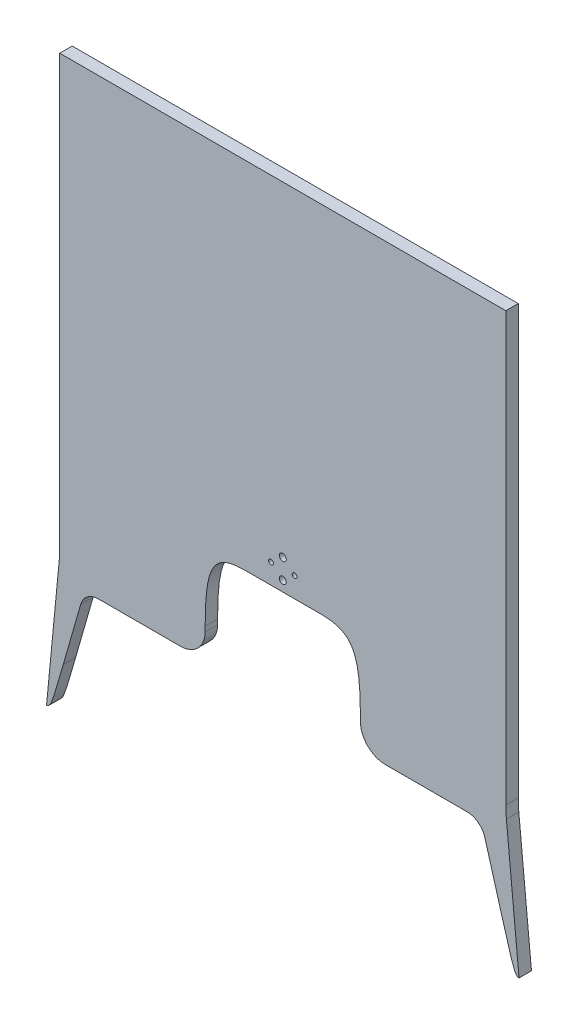
from build123d import *

# Parameters (mm, degrees)
BOSS_EXTRUDE1_DEPTH     = 12.7
FILLET2_SIZE            = 41.275
FILLET2_SIZE_2          = 69.85
FILLET3_R               = 25.4
FILLET4_R               = 19.05
FILLET5_START           = -1
FILLET5_DEPTH           = 15
FILLET6_R               = 127
CUT_EXTRUDE1_REACH      = 634.314
SKETCH3_W               = 241.600142069
SKETCH3_H               = 584.2
F_8_CLEARANCE_HOLE1_D   = 4.9149
F_1_4_CLEARANCE_HOLE1_D = 7.14248


with BuildPart() as part:
    # Sketch1 → Boss-Extrude1 (new body)
    with BuildSketch(Plane.XY):
        Polygon((-228.088766336, 0), (228.088766336, 0), (228.088766336, -443.878997916), (241.600142069, -584.2), (237.284597128, -584.2), (202.688766336, -463.55), (79.375, -463.55), (79.375, -363.22), (-79.375, -363.22), (-79.375, -463.55), (-202.688766336, -463.55), (-237.284597128, -584.2), (-241.600142069, -584.2), (-228.088766336, -443.878997916), align=None)
    extrude(amount=BOSS_EXTRUDE1_DEPTH)

    # Fillet2
    # a fillet whose section is not a circle: 69.85, 41.275 mm, written as the material it adds along each edge
    with BuildSketch(Plane(origin=(-79.375, -363.22, 0), x_dir=(1, 0, 0), z_dir=(0, 0, 1))) as fillet2_piece_1:
        with BuildLine():
            Bezier((FILLET2_SIZE, 0), (0, 0), (0, -FILLET2_SIZE_2), weights=[1, 1.5, 1])
            Line((0, -FILLET2_SIZE_2), (0, 0))
            Line((0, 0), (FILLET2_SIZE, 0))
        make_face()
    extrude(amount=12.7)

    # Fillet3
    fillet3_edges = [part.edges().sort_by_distance(p)[0] for p in [
        (-79.375, -463.55, 6.35),
    ]]
    fillet(fillet3_edges, radius=FILLET3_R)

    # Fillet4
    fillet4_edges = [part.edges().sort_by_distance(p)[0] for p in [
        (-202.688766336, -463.55, 6.35),
    ]]
    fillet(fillet4_edges, radius=FILLET4_R)

    # Fillet5: read off the stored shape, not the designer's step
    # Fillet5 outline → Fillet5 (cut)
    with BuildSketch(Plane.XY.offset(FILLET5_START)):
        with BuildLine():
            Line((-237.284597128, -584.2), (-224.526592015, -539.707548693))
            add(Edge.make_bspline(
                [(-224.526592015, -539.707548693), (-237.177095318, -583.825096633), (-241.600142069, -584.2)],
                knots=[0, 0, 0, 1, 1, 1], degree=2, weights=[1, 2.333333333, 1]))
            Line((-241.600142069, -584.2), (-237.284597128, -584.2))
        make_face()
    extrude(amount=FILLET5_DEPTH, mode=Mode.SUBTRACT)

    # Fillet6
    # the kernel refuses this fillet: 127 mm, written as the material it adds along each edge
    with BuildSketch(Plane(origin=(-228.088766336, -443.878997916, 0), x_dir=(0, 1, 0), z_dir=(0, 0, 1))) as fillet6_piece_1:
        with BuildLine():
            CenterArc((FILLET6_R * 0.0480334444852, FILLET6_R), FILLET6_R, 264.5, 5.5)
            Line((-FILLET6_R * 0.047812308035, FILLET6_R * 0.00460380163282), (0, 0))
            Line((0, 0), (FILLET6_R * 0.0480334444852, 0))
        make_face()
    extrude(amount=12.7)

    # Sketch3 → Cut-Extrude1 (cut, up to next)
    with BuildSketch(Plane.XY.offset(12.7), mode=Mode.PRIVATE) as cut_extrude1_sk1:
        with Locations((120.800071035, -292.1)):
            Rectangle(SKETCH3_W, SKETCH3_H)
    cut_extrude1_tool1 = extrude(cut_extrude1_sk1.sketch, amount=-CUT_EXTRUDE1_REACH, mode=Mode.PRIVATE) & part.part
    add(cut_extrude1_tool1.solids().sort_by_distance((120.800071, -292.1, 12.7))[0], mode=Mode.SUBTRACT)

    # Mirror5: part across plane


with BuildPart() as part_1:
    add(part.part)
    add(part.part.mirror(Plane(origin=(0, 0, -0.35025), x_dir=(0, 0, 1), z_dir=(-1, 0, 0))))

    # #8 Clearance Hole1 (through all)
    with Locations(Plane(origin=(0, 0, 0), x_dir=(-1, 0, 0), z_dir=(0, 0, -1))):
        with Locations((12.077216058, -342.5825), (-12.077216058, -342.5825)):
            Hole(F_8_CLEARANCE_HOLE1_D / 2)

    # 1/4 Clearance Hole1 (through all)
    with Locations(Plane(origin=(0, 0, 0), x_dir=(-1, 0, 0), z_dir=(0, 0, -1))):
        with Locations((0, -352.7425), (0, -332.4225)):
            Hole(F_1_4_CLEARANCE_HOLE1_D / 2)


solid = part_1.part
